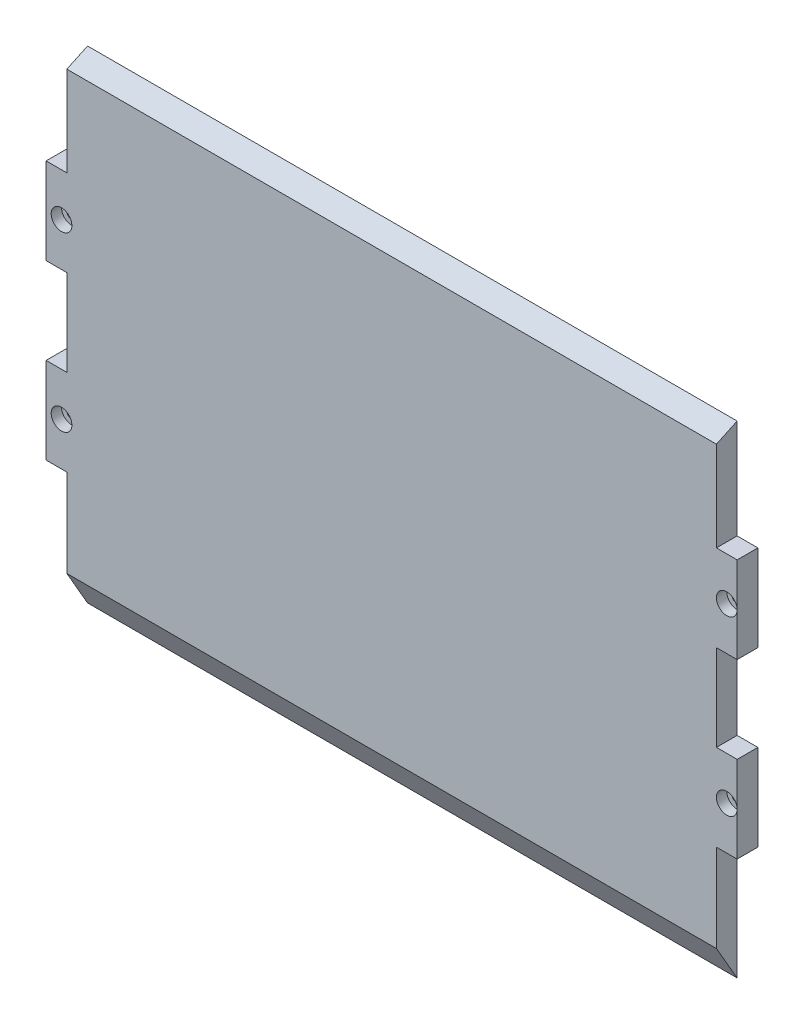
from build123d import *

# Parameters (mm, degrees)
ESQUISSE1_W                  = 188
ESQUISSE1_H                  = 139.6
BOSS_EXTRU_1_DEPTH           = 6
ENL_V_START                  = -189
ENL_V_MAT_EXTRU_3_DEPTH      = 190
ENL_V_MAT_EXTRU_4_DEPTH      = 235.239535519
ENL_V_MAT_EXTRU_4_DEPTH_BACK = 235.239535519
ESQUISSE7_W                  = 6
ESQUISSE7_H                  = 25
BOSS_EXTRU_3_DEPTH           = 6
ESQUISSE9_W                  = 6
ESQUISSE9_H                  = 25
BOSS_EXTRU_4_DEPTH           = 6
ESQUISSE11_R                 = 2.995
ENL_V_MAT_EXTRU_7_DEPTH      = 3
ESQUISSE12_R                 = 1.5
ENL_V_MAT_EXTRU_8_DEPTH      = 13


with BuildPart() as part:
    # Esquisse1 → Boss.-Extru.1 (new body)
    with BuildSketch(Plane.XY):
        with Locations((-94, 69.8)):
            Rectangle(ESQUISSE1_W, ESQUISSE1_H)
    extrude(amount=BOSS_EXTRU_1_DEPTH)

    # Enlèv. mat.-Extru.3: read off the stored shape, not the designer's step
    # Enlèv. mat.-Extru.3 outline → Enlèv. mat.-Extru.3 (cut)
    with BuildSketch(Plane(origin=(0, 0, 0), x_dir=(0, 0, -1), z_dir=(1, 0, 0)).offset(ENL_V_START)):
        Polygon((-6, 139.6), (-6, 136.802154051), (0, 139.6), align=None)
    extrude(amount=ENL_V_MAT_EXTRU_3_DEPTH, mode=Mode.SUBTRACT)

    # Esquisse4 → Enlèv. mat.-Extru.4 (cut, two sides: drawn at the far end of the back side and taken through both)
    with BuildSketch(Plane(origin=(0, 0, 0), x_dir=(0, 0, -1), z_dir=(1, 0, 0)).offset(-ENL_V_MAT_EXTRU_4_DEPTH_BACK)):
        Polygon((144.728880336, -250.677774065), (0, 0), (-6, 10.392304845), (-150.728880336, 261.07007891), (-652.084428466, -28.387681762), (-356.626667793, -540.135534737), align=None)
    extrude(amount=ENL_V_MAT_EXTRU_4_DEPTH + ENL_V_MAT_EXTRU_4_DEPTH_BACK, mode=Mode.SUBTRACT)

    # Esquisse7 → Boss.-Extru.3 (add)
    with BuildSketch(Plane(origin=(0, 0, 0), x_dir=(0, 0, -1), z_dir=(1, 0, 0))):
        with Locations((-3, 98.302154051)):
            Rectangle(ESQUISSE7_W, ESQUISSE7_H)
        with Locations((-3, 48.302154051)):
            Rectangle(ESQUISSE7_W, ESQUISSE7_H)
    extrude(amount=BOSS_EXTRU_3_DEPTH)

    # Esquisse9 → Boss.-Extru.4 (add)
    with BuildSketch(Plane.ZY.offset(188)):
        with Locations((3, 48.302154051)):
            Rectangle(ESQUISSE9_W, ESQUISSE9_H)
        with Locations((3, 98.302154051)):
            Rectangle(ESQUISSE9_W, ESQUISSE9_H)
    extrude(amount=BOSS_EXTRU_4_DEPTH)

    # Esquisse11 → Enlèv. mat.-Extru.7 (cut)
    with BuildSketch(Plane.XY.offset(6)):
        with Locations((3, 48.302154051)):
            Circle(ESQUISSE11_R)
        with Locations((3, 98.302154051)):
            Circle(ESQUISSE11_R)
        with Locations((-189.537877077, 48.302154051)):
            Circle(ESQUISSE11_R)
        with Locations((-189.537877077, 98.302154051)):
            Circle(ESQUISSE11_R)
    extrude(amount=-ENL_V_MAT_EXTRU_7_DEPTH, mode=Mode.SUBTRACT)

    # Esquisse12 → Enlèv. mat.-Extru.8 (cut)
    with BuildSketch(Plane.XY.offset(6)):
        with Locations((3, 98.302154051)):
            Circle(ESQUISSE12_R)
        with Locations((3, 48.302154051)):
            Circle(ESQUISSE12_R)
        with Locations((-189.537877077, 48.302154051)):
            Circle(ESQUISSE12_R)
        with Locations((-189.537877077, 98.302154051)):
            Circle(ESQUISSE12_R)
    extrude(amount=-ENL_V_MAT_EXTRU_8_DEPTH, mode=Mode.SUBTRACT)


solid = part.part
